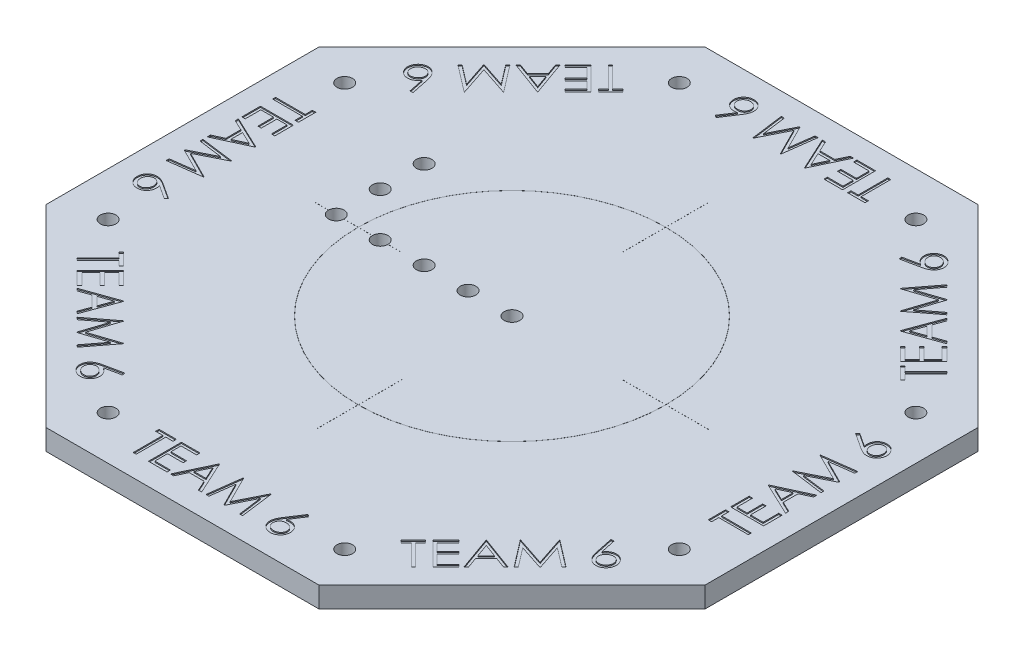
from build123d import *

# Parameters (mm, degrees)
BASE_DEPTH              = 5.9944
MOUNTING_HOLES_D        = 4.4958
F_8_CLEARANCE_HOLE1_D   = 4.4958
CUT_EXTRUDE1_DEPTH      = 0.3175
CIRPATTERN1_COUNT       = 8
SKETCH9_R               = 44.4754
SKETCH9_R_2             = 44.45
SKETCH9_W               = 0.0254
SKETCH9_H               = 25.4
SKETCH9_W_2             = 25.4
SKETCH9_H_2             = 0.0254
CUT_EXTRUDE_THIN2_DEPTH = 0.3175


with BuildPart() as part:
    # Sketch1 → Base (new body)
    with BuildSketch(Plane(origin=(0, 0, 0), x_dir=(1, 0, 0), z_dir=(0, 1, 0))):
        Polygon((-39.453841816, 95.25), (-95.25, 39.453841816), (-95.25, -39.453841816), (-39.453841816, -95.25), (39.453841816, -95.25), (95.25, -39.453841816), (95.25, 39.453841816), (39.453841816, 95.25), align=None)
    extrude(amount=BASE_DEPTH)

    # Mounting holes (through all)
    with Locations(Plane(origin=(0, 5.9944, 0), x_dir=(1, 0, 0), z_dir=(0, 1, 0))):
        with Locations((-34.193329574, 82.55), (34.193329574, 82.55), (82.55, 34.193329574), (82.55, -34.193329574), (34.193329574, -82.55), (-34.193329574, -82.55), (-82.55, -34.193329574), (-82.55, 34.193329574)):
            Hole(MOUNTING_HOLES_D / 2)

    # #8 Clearance Hole1 (through all)
    with Locations(Plane(origin=(0, 5.9944, 0), x_dir=(1, 0, 0), z_dir=(0, 1, 0))):
        with Locations((0, 0), (-12.7, 0), (-25.4, 0), (-38.1, 0), (-50.8, 0), (-50.8, 12.7), (-50.8, 25.4)):
            Hole(F_8_CLEARANCE_HOLE1_D / 2)

    # Sketch8 → Cut-Extrude1 (cut)
    # profile 1 of 5: a face of its own
    with BuildSketch(Plane(origin=(0, 5.9944, 0), x_dir=(1, 0, 0), z_dir=(0, 1, 0))):
        Polygon((-22.652403846, -80.351923077), (-22.652403846, -79.375), (-17.645673077, -79.375), (-17.645673077, -80.351923077), (-19.721634615, -80.351923077), (-19.721634615, -88.9), (-20.576442308, -88.9), (-20.576442308, -80.351923077), align=None)
    # profile 2 of 5: a face of its own
    with BuildSketch(Plane(origin=(0, 5.9944, 0), x_dir=(1, 0, 0), z_dir=(0, 1, 0))):
        Polygon((-16.180288462, -79.375), (-10.807211538, -79.375), (-10.807211538, -80.351923077), (-15.325480769, -80.351923077), (-15.325480769, -83.282692308), (-10.807211538, -83.282692308), (-10.807211538, -84.259615385), (-15.325480769, -84.259615385), (-15.325480769, -87.923076923), (-10.807211538, -87.923076923), (-10.807211538, -88.9), (-16.180288462, -88.9), align=None)
    # profile 3 of 5: a face of its own
    with BuildSketch(Plane(origin=(0, 5.9944, 0), x_dir=(1, 0, 0), z_dir=(0, 1, 0))):
        Polygon((-5.189903846, -79.375), (-0.79375, -88.9), (-1.722971755, -88.9), (-3.131114784, -85.847115385), (-7.449038462, -85.847115385), (-8.897250601, -88.9), (-9.830288462, -88.9), (-5.312019231, -79.375), align=None)
        Polygon((-5.260501803, -81.231535457), (-6.985381611, -84.870192308), (-3.581415264, -84.870192308), align=None, mode=Mode.SUBTRACT)
    # profile 4 of 5: a face of its own
    with BuildSketch(Plane(origin=(0, 5.9944, 0), x_dir=(1, 0, 0), z_dir=(0, 1, 0))):
        Polygon((0.427403846, -88.9), (1.684810697, -79.375), (1.806926082, -79.375), (5.739423077, -87.190384615), (9.662379808, -79.375), (9.786403245, -79.375), (11.051442308, -88.9), (10.19281851, -88.9), (9.280769231, -82.046274038), (5.842457933, -88.9), (5.649744591, -88.9), (2.198076923, -82.031009615), (1.287935697, -88.9), align=None)
    # profile 5 of 5: a face of its own
    with BuildSketch(Plane(origin=(0, 5.9944, 0), x_dir=(1, 0, 0), z_dir=(0, 1, 0))):
        with BuildLine():
            Line((20.210096154, -79.130769231), (20.868374399, -79.647851563))
            Line((20.868374399, -79.647851563), (18.351652644, -83.496394231))
            add(Edge.make_bspline(
                [(18.351652644, -83.496394231), (18.519211755, -83.46968651), (18.846054746, -83.417590081), (19.176887656, -83.408995958), (19.338115986, -83.404807692)],
                knots=[0, 0, 0, 0, 1.025318673, 2, 2, 2, 2], degree=3))
            add(Edge.make_bspline(
                [(19.338115986, -83.404807692), (19.434923993, -83.407409682), (19.625487676, -83.412531621), (19.905269045, -83.451948386), (20.174116078, -83.514065298), (20.430914465, -83.604613366), (20.676585938, -83.720280488), (20.912540315, -83.858906985), (21.134342214, -84.027651015), (21.344847924, -84.216150644), (21.535965953, -84.424930438), (21.705173647, -84.646458361), (21.84730513, -84.880503616), (21.962622731, -85.126947658), (22.052171008, -85.3854106), (22.11745167, -85.655561751), (22.156040419, -85.937587399), (22.161280505, -86.129388719), (22.163942308, -86.226817909)],
                knots=[0, 0, 0, 0, 1.04369286, 2.054478336, 3.041073146, 4.015093852, 4.984733326, 5.965804835, 6.960378782, 7.985147595, 9.009457201, 10.008161701, 10.986880575, 11.956520048, 12.937015923, 13.931873656, 14.949455224, 16, 16, 16, 16], degree=3))
            add(Edge.make_bspline(
                [(22.163942308, -86.226817909), (22.160069429, -86.360112674), (22.152448521, -86.622405228), (22.076510334, -87.004430408), (21.958510158, -87.368373896), (21.789842741, -87.708425027), (21.580340685, -88.024117734), (21.324859522, -88.303841037), (21.032459743, -88.553314495), (20.701842099, -88.761930009), (20.346034461, -88.932299741), (19.972240811, -89.054669435), (19.58409122, -89.13000802), (19.320644394, -89.139453017), (19.187379808, -89.144230769)],
                knots=[0, 0, 0, 0, 1.031375318, 2.029502543, 3.004789286, 3.987476834, 4.960371455, 5.9300674, 6.912260825, 7.929083631, 8.949397511, 9.960523116, 10.96833055, 12, 12, 12, 12], degree=3))
            add(Edge.make_bspline(
                [(19.187379808, -89.144230769), (19.059209501, -89.140071866), (18.805326564, -89.131833808), (18.431857317, -89.058447934), (18.073001534, -88.939502176), (17.731273433, -88.775633318), (17.414715194, -88.568647222), (17.131507997, -88.31946702), (16.883063954, -88.033419119), (16.67630445, -87.710547888), (16.512314615, -87.363593075), (16.389333461, -87.001814099), (16.317497971, -86.626529149), (16.307459827, -86.372126906), (16.302403846, -86.243990385)],
                knots=[0, 0, 0, 0, 1.012016664, 2.004627821, 2.994792927, 3.992885782, 4.990978636, 5.973936114, 6.964471063, 7.975201453, 8.993600317, 9.990122807, 10.98767138, 12, 12, 12, 12], degree=3))
            add(Edge.make_bspline(
                [(16.302403846, -86.243990385), (16.305619064, -86.145897626), (16.312183926, -85.945610955), (16.358022009, -85.642269565), (16.431676915, -85.331887692), (16.514164086, -85.068578066), (16.601319496, -84.852873495), (16.673852478, -84.67896471), (16.764133139, -84.500000646), (16.860399269, -84.309844537), (16.971316177, -84.113397038), (17.091918051, -83.907374909), (17.225539244, -83.695054692), (17.319211258, -83.550970846), (17.367097356, -83.477313702)],
                knots=[0, 0, 0, 0, 1.173818275, 2.396712641, 3.66331629, 4.989737886, 5.693666774, 6.447286557, 7.243889047, 8.091586357, 8.998013824, 9.943181721, 10.948533338, 12, 12, 12, 12], degree=3))
            Line((17.367097356, -83.477313702), (20.210096154, -79.130769231))
        make_face()
        with BuildLine():
            add(Edge.make_bspline(
                [(19.158759014, -84.381730769), (19.08619962, -84.38384816), (18.944470043, -84.387984038), (18.736532722, -84.412001331), (18.539737373, -84.457228931), (18.351476745, -84.514831591), (18.175270497, -84.594033489), (18.009838011, -84.690240885), (17.854539548, -84.803509948), (17.71100174, -84.932235999), (17.580863942, -85.073173432), (17.468792436, -85.224129774), (17.372120761, -85.381466999), (17.293520954, -85.546499713), (17.232315819, -85.71916483), (17.188042937, -85.898668215), (17.163403799, -86.086213577), (17.159304698, -86.213392745), (17.157211538, -86.278335337)],
                knots=[0, 0, 0, 0, 1.129588631, 2.206414736, 3.251139165, 4.268635594, 5.265702196, 6.250456724, 7.242448911, 8.251968645, 9.246821453, 10.222880186, 11.173611482, 12.116736599, 13.062300278, 14.020270554, 14.989073742, 16, 16, 16, 16], degree=3))
            add(Edge.make_bspline(
                [(17.157211538, -86.278335337), (17.158916136, -86.342697068), (17.162258599, -86.46890084), (17.192608841, -86.654881036), (17.238968601, -86.833855537), (17.307930678, -87.004901674), (17.390190996, -87.170626653), (17.498790485, -87.32502768), (17.619123309, -87.4774823), (17.762961514, -87.616279161), (17.917330094, -87.745428974), (18.082251938, -87.858314521), (18.254137258, -87.954887607), (18.435306628, -88.030573523), (18.623189659, -88.092688189), (18.819351738, -88.136398358), (19.023929295, -88.161110361), (19.162509712, -88.165214802), (19.233173077, -88.167307692)],
                knots=[0, 0, 0, 0, 0.989467248, 1.94019797, 2.891935182, 3.827694429, 4.772920941, 5.730924762, 6.725747692, 7.756678648, 8.79901574, 9.819492441, 10.826891316, 11.826466727, 12.835195252, 13.867842842, 14.912794438, 16, 16, 16, 16], degree=3))
            add(Edge.make_bspline(
                [(19.233173077, -88.167307692), (19.303836326, -88.165214638), (19.442416516, -88.161109875), (19.646995719, -88.136400205), (19.843151715, -88.092681413), (20.031056856, -88.030598088), (20.212144608, -87.954796479), (20.3838796, -87.858915326), (20.547241769, -87.744734748), (20.701711686, -87.616499869), (20.84495119, -87.476692322), (20.96817007, -87.326388577), (21.073443726, -87.169378762), (21.158989621, -87.005554504), (21.227192135, -86.833752113), (21.273786985, -86.654908743), (21.30407455, -86.468893587), (21.307425625, -86.342694618), (21.309134615, -86.278335337)],
                knots=[0, 0, 0, 0, 1.087397944, 2.132534446, 3.165364764, 4.174271784, 5.174024072, 6.181601208, 7.194203697, 8.236725232, 9.267838612, 10.269026844, 11.221737037, 12.171628256, 13.107553087, 14.05945871, 15.010357665, 16, 16, 16, 16], degree=3))
            add(Edge.make_bspline(
                [(21.309134615, -86.278335337), (21.307637032, -86.213308023), (21.304697764, -86.085680554), (21.271452932, -85.898752108), (21.225345472, -85.718252796), (21.155723081, -85.545317035), (21.065272199, -85.380627262), (20.955099498, -85.223351548), (20.827648003, -85.072284103), (20.680425413, -84.931959603), (20.520159848, -84.803652198), (20.349756005, -84.690387548), (20.171480734, -84.594797433), (19.98551479, -84.515040247), (19.789727374, -84.457483464), (19.58727938, -84.412162853), (19.375581512, -84.388045504), (19.231953742, -84.383862491), (19.158759014, -84.381730769)],
                knots=[0, 0, 0, 0, 0.978206639, 1.919901502, 2.851605144, 3.780102724, 4.718870031, 5.675451981, 6.667674623, 7.690630536, 8.733308323, 9.756129687, 10.767539656, 11.776269907, 12.797430371, 13.836405707, 14.897401972, 16, 16, 16, 16], degree=3))
        make_face(mode=Mode.SUBTRACT)
    cut_extrude1 = extrude(amount=-CUT_EXTRUDE1_DEPTH, mode=Mode.SUBTRACT)

    # CirPattern1: Cut-Extrude1 ×8 about axis
    cirpattern1_axis = Axis((0, 6.29412, 0), (0, -1, 0))
    for i in range(1, CIRPATTERN1_COUNT):
        add(cut_extrude1.rotate(cirpattern1_axis, i * 360 / CIRPATTERN1_COUNT), mode=Mode.SUBTRACT)

    # Sketch9 → Cut-Extrude-Thin2 (cut)
    # profile 1 of 5: a face of its own
    with BuildSketch(Plane(origin=(0, 5.9944, 0), x_dir=(1, 0, 0), z_dir=(0, 1, 0))):
        Circle(SKETCH9_R)
        Circle(SKETCH9_R_2, mode=Mode.SUBTRACT)
    # profile 2 of 5: a face of its own
    with BuildSketch(Plane(origin=(0, 5.9944, 0), x_dir=(1, 0, 0), z_dir=(0, 1, 0))):
        with Locations((-0.0127, 44.45)):
            Rectangle(SKETCH9_W, SKETCH9_H)
    # profile 3 of 5: a face of its own
    with BuildSketch(Plane(origin=(0, 5.9944, 0), x_dir=(1, 0, 0), z_dir=(0, 1, 0))):
        with Locations((44.45, 0.0127)):
            Rectangle(SKETCH9_W_2, SKETCH9_H_2)
    # profile 4 of 5: a face of its own
    with BuildSketch(Plane(origin=(0, 5.9944, 0), x_dir=(1, 0, 0), z_dir=(0, 1, 0))):
        with Locations((0.0127, -44.45)):
            Rectangle(SKETCH9_W, SKETCH9_H)
    # profile 5 of 5: a face of its own
    with BuildSketch(Plane(origin=(0, 5.9944, 0), x_dir=(1, 0, 0), z_dir=(0, 1, 0))):
        with Locations((-44.45, -0.0127)):
            Rectangle(SKETCH9_W_2, SKETCH9_H_2)
    extrude(amount=-CUT_EXTRUDE_THIN2_DEPTH, mode=Mode.SUBTRACT)


solid = part.part
